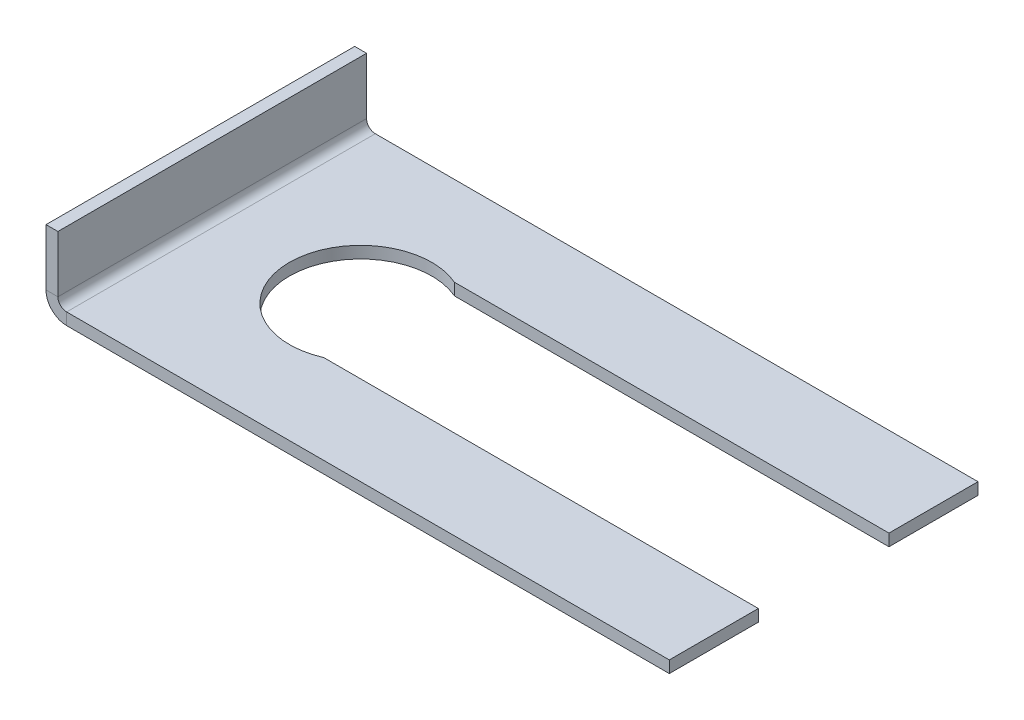
from build123d import *

# Parameters (mm, degrees)
T_LE_DE_BASE_PLI_E1_DEPTH             = 1
T_LE_PLI_E_SUR_AR_TE1_STRIP_W         = 5.4732
T_LE_PLI_E_SUR_AR_TE1_STRIP_H         = 1
T_LE_PLI_E_SUR_AR_TE1_STRIP_CUT_DEPTH = 26
T_LE_PLI_E_SUR_AR_TE1_DEPTH           = 26


# Sheet-metal steps are written as plain solids
with BuildPart() as part:
    # Esquisse1 → Tôle de base pliée1 (new body)
    with BuildSketch(Plane(origin=(0, 0, 0), x_dir=(1, 0, 0), z_dir=(0, 1, 0))):
        with BuildLine():
            Line((-26.25, -13), (26.25, -13))
            Line((26.25, -13), (26.25, -5.5))
            Line((26.25, -5.5), (-10.352084238, -5.5))
            ThreePointArc((-10.352084238, -5.5), (-18.75, 0), (-10.352084238, 5.5))
            Line((-10.352084238, 5.5), (26.25, 5.5))
            Line((26.25, 5.5), (26.25, 13))
            Line((26.25, 13), (-26.25, 13))
            Line((-26.25, 13), (-26.25, -13))
        make_face()
    extrude(amount=-T_LE_DE_BASE_PLI_E1_DEPTH)

    # Tôle pliée sur arête1 strip (across the edge) → Tôle pliée sur arête1 strip cut (cut)
    with BuildSketch(Plane(origin=(-26.25, 0, -13), x_dir=(1, 0, 0), z_dir=(0, 0, 1))):
        with Locations((-1, -0.5)):
            Rectangle(T_LE_PLI_E_SUR_AR_TE1_STRIP_W, T_LE_PLI_E_SUR_AR_TE1_STRIP_H)
    extrude(amount=T_LE_PLI_E_SUR_AR_TE1_STRIP_CUT_DEPTH, mode=Mode.SUBTRACT)

    # Tôle pliée sur arête1 section (across the edge) → Tôle pliée sur arête1 (add)
    with BuildSketch(Plane(origin=(-26.25, 0, -13), x_dir=(1, 0, 0), z_dir=(0, 0, 1))):
        with BuildLine():
            Line((0, 0.7366), (0, 5.5))
            Line((0, 5.5), (1, 5.5))
            Line((1, 5.5), (1, 0.7366))
            ThreePointArc((1, 0.7366), (1.215745145, 0.215745145), (1.7366, 0))
            Line((1.7366, 0), (1.7366, -1))
            ThreePointArc((1.7366, -1), (0.508638364, -0.491361636), (0, 0.7366))
        make_face()
    extrude(amount=T_LE_PLI_E_SUR_AR_TE1_DEPTH)


solid = part.part
